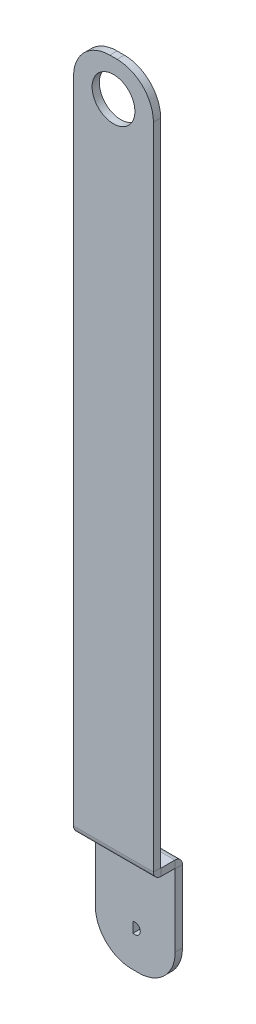
from build123d import *

# Parameters (mm, degrees)
BASE_FLANGE1_DEPTH      = 11
FILLET1_R               = 10
CUT_EXTRUDE1_DEPTH      = 190.414888538
CUT_EXTRUDE1_DEPTH_BACK = 190.414888538
SKETCH7_R               = 5.894184215
BODY_MOVE_COPY1_ANGLE   = 120


# Sheet-metal steps are written as plain solids
with BuildPart() as part:
    # Sketch2 → Base-Flange1 (new, symmetric)
    with BuildSketch(Plane.XY):
        with BuildLine():
            Line((-189, 0), (-0.1, 0))
            ThreePointArc((-0.1, 0), (-0.029289322, 0.029289322), (0, 0.1))
            Line((0, 0.1), (0, 3.9))
            ThreePointArc((0, 3.9), (0.61507576, 5.38492424), (2.1, 6))
            Line((2.1, 6), (32, 6))
            Line((32, 6), (32, 4))
            Line((32, 4), (2.1, 4))
            ThreePointArc((2.1, 4), (2.029289322, 3.970710678), (2, 3.9))
            Line((2, 3.9), (2, 0.1))
            ThreePointArc((2, 0.1), (1.38492424, -1.38492424), (-0.1, -2))
            Line((-0.1, -2), (-189, -2))
            Line((-189, -2), (-189, 0))
        make_face()
    extrude(amount=BASE_FLANGE1_DEPTH, both=True)

    # Fillet1
    fillet1_edges = [part.edges().sort_by_distance(p)[0] for p in [
        (-189, -1, -11),
        (32, 5, -11),
        (-189, -1, 11),
        (32, 5, 11),
    ]]
    fillet(fillet1_edges, radius=FILLET1_R)

    # Sketch7 → Cut-Extrude1 (cut, two sides: drawn at the far end of the back side and taken through both)
    with BuildSketch(Plane(origin=(0, 0, 0), x_dir=(1, 0, 0), z_dir=(0, 1, 0)).offset(-CUT_EXTRUDE1_DEPTH_BACK)):
        with Locations(Location((-179, 0, 0), (0, 0, 270))):
            Circle(SKETCH7_R)
        with BuildLine():
            Line((20.46881318, 0.616566496), (23.297240305, 0.616566496))
            ThreePointArc((23.297240305, 0.616566496), (21.883026743, -1.383433504), (20.46881318, 0.616566496))
        make_face()
    extrude(amount=CUT_EXTRUDE1_DEPTH + CUT_EXTRUDE1_DEPTH_BACK, mode=Mode.SUBTRACT)


with BuildPart() as part_1:
    # Body-Move/Copy1: moved
    add(part.part.moved(Location((0, 0, 0))).rotate(Axis((-95.951666667, -47.903333333, 48.048333333), (-0.5773502691898587, 0.5773502691889744, -0.5773502691900443)), BODY_MOVE_COPY1_ANGLE))


solid = part_1.part
